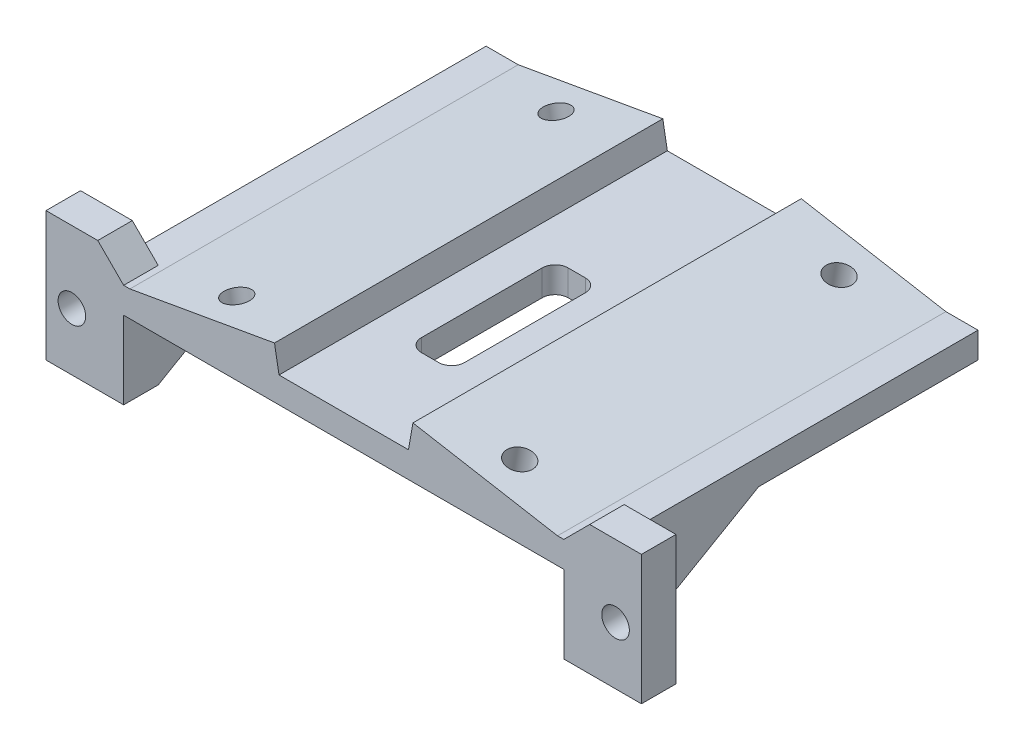
from build123d import *

# Parameters (mm, degrees)
SKETCH_1_W          = 57
SKETCH_1_H          = 45
EXTRUDE_1_DEPTH     = 3
SKETCH_2_W          = 4
SKETCH_2_H          = 15
EXTRUDE_2_DEPTH     = 6
SKETCH_3_W          = 4
SKETCH_3_H          = 15
EXTRUDE_3_DEPTH     = 6
EXTRUDE_4_DEPTH     = 3
SKETCH_5_W          = 4
SKETCH_5_H          = 9
EXTRUDE_5_DEPTH     = 3
CHAMFER_1_SIZE      = 3
SKETCH_6_R          = 1.6
CUT_EXTRUDE_1_DEPTH = 4
SKETCH_8_W          = 8
SKETCH_8_H          = 3
EXTRUDE_6_DEPTH     = 9
EXTRUDE_7_DEPTH     = 3
EXTRUDE_8_DEPTH     = 3
SKETCH_11_R         = 1.6
CUT_EXTRUDE_3_DEPTH = 3
SKETCH_12_W         = 5
SKETCH_12_H         = 17
CUT_EXTRUDE_4_DEPTH = 3
FILLET_1_R          = 1.5
EXTRUDE_9_REACH     = 80.57
SKETCH_15_W         = 45
SKETCH_15_H         = 17.726539555
SKETCH_16_R         = 1.5
CUT_EXTRUDE_5_DEPTH = 79.570276896


with BuildPart() as part:
    # 草图1 → 凸台-拉伸1 (new body)
    with BuildSketch(Plane(origin=(0, 0, 0), x_dir=(1, 0, 0), z_dir=(0, 1, 0))):
        with Locations((28.5, 22.5)):
            Rectangle(SKETCH_1_W, SKETCH_1_H)
    extrude(amount=EXTRUDE_1_DEPTH)

    # 草图2 → 凸台-拉伸2 (add)
    with BuildSketch(Plane.ZY):
        with Locations((-2, -1.5)):
            Rectangle(SKETCH_2_W, SKETCH_2_H)
    extrude(amount=EXTRUDE_2_DEPTH)

    # 草图3 → 凸台-拉伸3 (add)
    with BuildSketch(Plane(origin=(57, 0, 0), x_dir=(0, 0, -1), z_dir=(1, 0, 0))):
        with Locations((2, -1.5)):
            Rectangle(SKETCH_3_W, SKETCH_3_H)
    extrude(amount=EXTRUDE_3_DEPTH)

    # 草图4 → 凸台-拉伸4 (add)
    with BuildSketch(Plane.ZY.offset(-57)):
        Polygon((-4, -9), (-19.588457268, 0), (0, 0), (0, -9), align=None)
    extrude(amount=EXTRUDE_4_DEPTH)

    # 草图5 → 凸台-拉伸5 (add)
    with BuildSketch(Plane(origin=(0, 0, 0), x_dir=(0, 0, -1), z_dir=(1, 0, 0))):
        Polygon((19.588457268, 0), (4, 0), (4, -9), align=None)
        with Locations((2, -4.5)):
            Rectangle(SKETCH_5_W, SKETCH_5_H)
    extrude(amount=EXTRUDE_5_DEPTH)

    # 倒角1
    chamfer_1_edges = [part.edges().sort_by_distance(p)[0] for p in [
        (0, 3, -2),
        (57, 3, -2),
    ]]
    chamfer(chamfer_1_edges, length=CHAMFER_1_SIZE - 0.0001)  # a hair under: the kernel refuses the full size

    # 草图6 → 切除-拉伸1 (cut)
    with BuildSketch(Plane(origin=(0, 0, -4), x_dir=(-1, 0, 0), z_dir=(0, 0, -1))):
        with Locations(Location((3, -2.323268139, 0), (0, 0, 90))):
            Circle(SKETCH_6_R)
        with Locations(Location((-60, -2.323268139, 0), (0, 0, 90))):
            Circle(SKETCH_6_R)
    extrude(amount=-CUT_EXTRUDE_1_DEPTH, mode=Mode.SUBTRACT)

    # 草图8 → 凸台-拉伸6 (add)
    with BuildSketch(Plane.XZ):
        with Locations((28, -43.5)):
            Rectangle(SKETCH_8_W, SKETCH_8_H)
    extrude(amount=EXTRUDE_6_DEPTH)

    # 草图9 → 凸台-拉伸7 (add)
    with BuildSketch(Plane(origin=(32, 0, 0), x_dir=(0, 0, -1), z_dir=(1, 0, 0))):
        Polygon((45, 0), (29.146667939, 0), (42, -9), (45, -9), align=None)
    extrude(amount=EXTRUDE_7_DEPTH)

    # 草图10 → 凸台-拉伸8 (add)
    with BuildSketch(Plane.ZY.offset(-24)):
        Polygon((-45, 0), (-45, -9), (-42, -9), (-29.146667939, 0), align=None)
    extrude(amount=EXTRUDE_8_DEPTH)

    # 草图11 → 切除-拉伸3 (cut)
    with BuildSketch(Plane.XY.offset(-42)):
        with Locations((28, -4.5)):
            Circle(SKETCH_11_R)
    extrude(amount=-CUT_EXTRUDE_3_DEPTH, mode=Mode.SUBTRACT)

    # 草图12 → 切除-拉伸4 (cut)
    with BuildSketch(Plane(origin=(0, 3, 0), x_dir=(1, 0, 0), z_dir=(0, 1, 0))):
        with Locations((28, 19)):
            Rectangle(SKETCH_12_W, SKETCH_12_H)
    extrude(amount=-CUT_EXTRUDE_4_DEPTH, mode=Mode.SUBTRACT)

    # 圆角1
    fillet_1_edges = [part.edges().sort_by_distance(p)[0] for p in [
        (25.5, 1.5, -27.5),
        (30.5, 1.5, -27.5),
        (30.5, 1.5, -10.5),
        (25.5, 1.5, -10.5),
    ]]
    fillet(fillet_1_edges, radius=FILLET_1_R)

    # 草图15 → 凸台-拉伸9 (add, up to next)
    with BuildSketch(Plane(origin=(2.119507574, 12.02032477, 0), x_dir=(0, 0, 1), z_dir=(0.17364817766693066, 0.9848077530122081, 0)), mode=Mode.PRIVATE) as extrude_9_sk1:
        with Locations((-22.5, 43.795404353)):
            Rectangle(SKETCH_15_W, SKETCH_15_H)
    extrude_9_tool1 = extrude(extrude_9_sk1.sketch, amount=-EXTRUDE_9_REACH, mode=Mode.PRIVATE) - part.part
    extrude_9 = extrude_9_tool1.solids().sort_by_distance((45.249561, 4.415333, -22.5))[0]
    add(extrude_9)

    # 草图16 → 切除-拉伸5 (cut, through all)
    with BuildSketch(Plane(origin=(2.119507574, 12.02032477, 0), x_dir=(0.9848077530122081, -0.17364817766693064, 0), z_dir=(0.17364817766693064, 0.9848077530122081, 0))):
        with Locations(Location((43.439057305, 41, 0), (0, 0, 180))):
            Circle(SKETCH_16_R)
        with Locations((43.439057305, 4)):
            Circle(SKETCH_16_R)
    cut_extrude_5 = extrude(amount=-CUT_EXTRUDE_5_DEPTH, mode=Mode.SUBTRACT)

    # 镜向1: 凸台-拉伸9, 切除-拉伸5 across plane
    add(extrude_9.mirror(Plane(origin=(28.5, 0, 0), x_dir=(0, 0, 1), z_dir=(1, 0, 0))))
    add(cut_extrude_5.mirror(Plane(origin=(28.5, 0, 0), x_dir=(0, 0, 1), z_dir=(1, 0, 0))), mode=Mode.SUBTRACT)


solid = part.part
